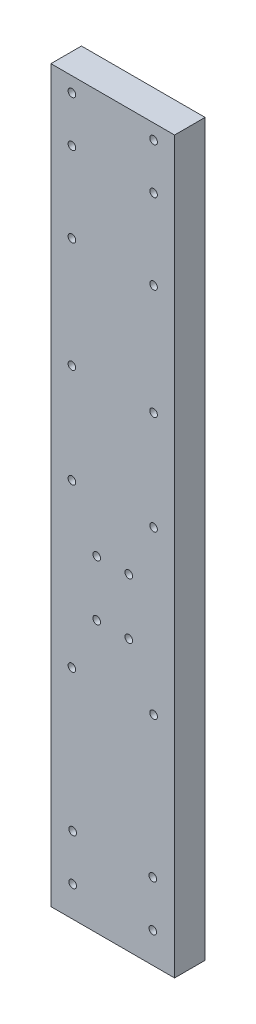
from build123d import *

# Parameters (mm, degrees)
SKETCH3_W           = 16.2
SKETCH3_H           = 95.66
SKETCH3_R           = 0.5
BOSS_EXTRUDE3_DEPTH = 4


with BuildPart() as part:
    # Sketch3 → Boss-Extrude3 (new body)
    with BuildSketch(Plane.XY):
        with Locations((8.1, 47.676448831)):
            Rectangle(SKETCH3_W, SKETCH3_H)
        with Locations((6, 35.346448831)):
            Circle(SKETCH3_R, mode=Mode.SUBTRACT)
        with Locations((10.2, 35.346448831)):
            Circle(SKETCH3_R, mode=Mode.SUBTRACT)
        with Locations((2.75, 87.561448831)):
            Circle(SKETCH3_R, mode=Mode.SUBTRACT)
        with Locations((10.2, 42.666448831)):
            Circle(SKETCH3_R, mode=Mode.SUBTRACT)
        with Locations((13.45, 49.606448831)):
            Circle(SKETCH3_R, mode=Mode.SUBTRACT)
        with Locations((2.75, 93.561448831)):
            Circle(SKETCH3_R, mode=Mode.SUBTRACT)
        with Locations((13.45, 87.561448831)):
            Circle(SKETCH3_R, mode=Mode.SUBTRACT)
        with Locations((2.75, 62.606448831)):
            Circle(SKETCH3_R, mode=Mode.SUBTRACT)
        with Locations((2.85, 9.846448831)):
            Circle(SKETCH3_R, mode=Mode.SUBTRACT)
        with Locations((13.35, 9.846448831)):
            Circle(SKETCH3_R, mode=Mode.SUBTRACT)
        with Locations((13.35, 3.846448831)):
            Circle(SKETCH3_R, mode=Mode.SUBTRACT)
        with Locations((2.85, 3.846448831)):
            Circle(SKETCH3_R, mode=Mode.SUBTRACT)
        with Locations((13.45, 62.606448831)):
            Circle(SKETCH3_R, mode=Mode.SUBTRACT)
        with Locations((2.75, 77.061448831)):
            Circle(SKETCH3_R, mode=Mode.SUBTRACT)
        with Locations((13.45, 28.346448831)):
            Circle(SKETCH3_R, mode=Mode.SUBTRACT)
        with Locations((13.45, 77.061448831)):
            Circle(SKETCH3_R, mode=Mode.SUBTRACT)
        with Locations((13.45, 93.561448831)):
            Circle(SKETCH3_R, mode=Mode.SUBTRACT)
        with Locations((2.75, 28.346448831)):
            Circle(SKETCH3_R, mode=Mode.SUBTRACT)
        with Locations((6, 42.606448831)):
            Circle(SKETCH3_R, mode=Mode.SUBTRACT)
        with Locations((2.75, 49.606448831)):
            Circle(SKETCH3_R, mode=Mode.SUBTRACT)
    extrude(amount=BOSS_EXTRUDE3_DEPTH)


solid = part.part
